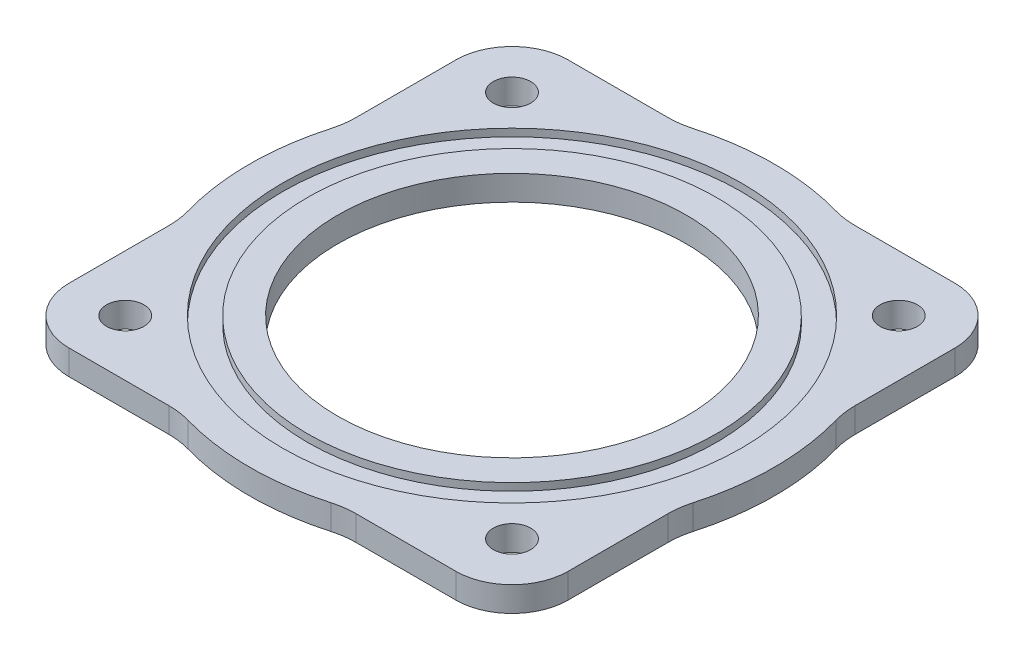
from build123d import *

# Parameters (mm, degrees)
SKETCH1_R           = 22.1742
SKETCH1_R_2         = 2.38125
BOSS_EXTRUDE1_DEPTH = 3.175
SKETCH2_R           = 29.21
SKETCH2_R_2         = 26.035
CUT_EXTRUDE1_DEPTH  = 0.9525


with BuildPart() as part:
    # Sketch1 → Boss-Extrude1 (new body)
    with BuildSketch(Plane(origin=(0, 0, 0), x_dir=(1, 0, 0), z_dir=(0, 1, 0))):
        with BuildLine():
            Line((0, 43.62908334), (0, 56.35625))
            ThreePointArc((0, 56.35625), (2.092355932, 61.407644068), (7.14375, 63.5))
            Line((7.14375, 63.5), (19.87091666, 63.5))
            ThreePointArc((19.87091666, 63.5), (21.269548228, 63.596728676), (22.641548343, 63.885072886))
            ThreePointArc((22.641548343, 63.885072886), (31.75, 65.151), (40.858451657, 63.885072886))
            ThreePointArc((40.858451657, 63.885072886), (42.230451772, 63.596728676), (43.62908334, 63.5))
            Line((43.62908334, 63.5), (56.35625, 63.5))
            ThreePointArc((56.35625, 63.5), (61.407644068, 61.407644068), (63.5, 56.35625))
            Line((63.5, 56.35625), (63.5, 43.62908334))
            ThreePointArc((63.5, 43.62908334), (63.596728676, 42.230451772), (63.885072886, 40.858451657))
            ThreePointArc((63.885072886, 40.858451657), (65.151, 31.75), (63.885072886, 22.641548343))
            ThreePointArc((63.885072886, 22.641548343), (63.596728676, 21.269548228), (63.5, 19.87091666))
            Line((63.5, 19.87091666), (63.5, 7.14375))
            ThreePointArc((63.5, 7.14375), (61.407644068, 2.092355932), (56.35625, 0))
            Line((56.35625, 0), (43.62908334, 0))
            ThreePointArc((43.62908334, 0), (42.230451772, -0.096728676), (40.858451657, -0.385072886))
            ThreePointArc((40.858451657, -0.385072886), (31.75, -1.651), (22.641548343, -0.385072886))
            ThreePointArc((22.641548343, -0.385072886), (21.269548228, -0.096728676), (19.87091666, 0))
            Line((19.87091666, 0), (7.14375, 0))
            ThreePointArc((7.14375, 0), (2.092355932, 2.092355932), (0, 7.14375))
            Line((0, 7.14375), (0, 19.87091666))
            ThreePointArc((0, 19.87091666), (-0.096728676, 21.269548228), (-0.385072886, 22.641548343))
            ThreePointArc((-0.385072886, 22.641548343), (-1.651, 31.75), (-0.385072886, 40.858451657))
            ThreePointArc((-0.385072886, 40.858451657), (-0.096728676, 42.230451772), (0, 43.62908334))
        make_face()
        with Locations((31.75, 31.75)):
            Circle(SKETCH1_R, mode=Mode.SUBTRACT)
        with Locations((56.35625, 56.35625)):
            Circle(SKETCH1_R_2, mode=Mode.SUBTRACT)
        with Locations((56.35625, 7.14375)):
            Circle(SKETCH1_R_2, mode=Mode.SUBTRACT)
        with Locations((7.14375, 7.14375)):
            Circle(SKETCH1_R_2, mode=Mode.SUBTRACT)
        with Locations((7.14375, 56.35625)):
            Circle(SKETCH1_R_2, mode=Mode.SUBTRACT)
    extrude(amount=-BOSS_EXTRUDE1_DEPTH)

    # Sketch2 → Cut-Extrude1 (cut)
    with BuildSketch(Plane(origin=(0, 0, 0), x_dir=(1, 0, 0), z_dir=(0, 1, 0))):
        with Locations((31.75, 31.75)):
            Circle(SKETCH2_R)
        with Locations((31.75, 31.75)):
            Circle(SKETCH2_R_2, mode=Mode.SUBTRACT)
    extrude(amount=-CUT_EXTRUDE1_DEPTH, mode=Mode.SUBTRACT)


solid = part.part
